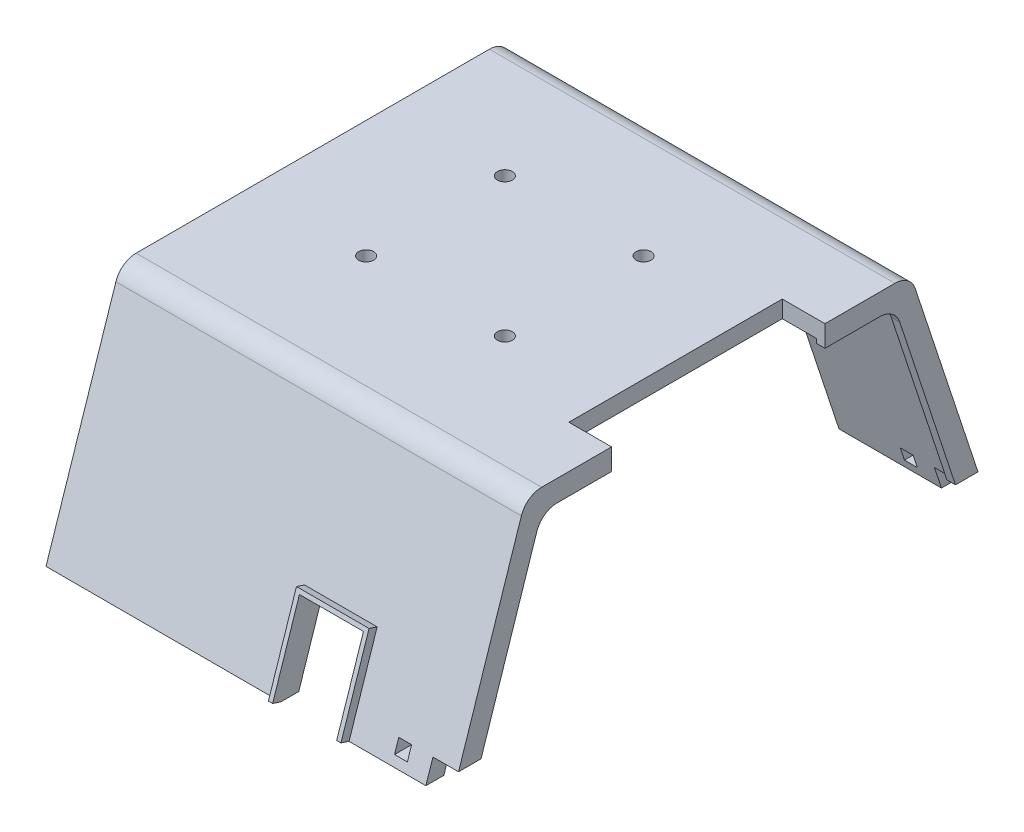
from build123d import *

# Parameters (mm, degrees)
EXTRUDE_1_DEPTH          = 95
EXTRUDE_3_DEPTH          = 20
CUT_EXTRUDE_1_DEPTH      = 142.209950074
CUT_EXTRUDE_1_DEPTH_BACK = 142.209950074
SKETCH_4_W               = 7
SKETCH_4_H               = 3
CUT_EXTRUDE_2_DEPTH      = 142.209950074
SHELL_START              = 2
SHELL_1_DEPTH            = 91
SHELL_START_2            = 93
SHELL_1_2_DEPTH          = 2.83772234
SHELL_1_3_DEPTH          = 3
CUT_EXTRUDE_3_DEPTH      = 3
SKETCH_7_R               = 1.75
SKETCH_7_W               = 10
SKETCH_7_H               = 50
CUT_EXTRUDE_4_DEPTH      = 142.209950074
SKETCH_9_W               = 15
SKETCH_9_H               = 20
CUT_EXTRUDE_5_DEPTH      = 3
EXTRUDE_4_DEPTH          = 2
EXTRUDE_6_DEPTH          = 2
SKETCH_13_W              = 40
SKETCH_13_H              = 28
CUT_EXTRUDE_6_DEPTH      = 2
CUT_EXTRUDE_7_DEPTH      = 10
FILLET_1_R               = 5
FILLET_2_R               = 5
EXTRUDE_7_DEPTH          = 2
EXTRUDE_8_DEPTH          = 2
SKETCH_17_R              = 1.75
EXTRUDE_9_DEPTH          = 2
SKETCH_18_W              = 120.1322677
SKETCH_18_H              = 134.585681159
CUT_EXTRUDE_8_DEPTH      = 2
SKETCH_20_W              = 175.540954957
SKETCH_20_H              = 97.306035525
CUT_EXTRUDE_9_DEPTH      = 39
CUT_EXTRUDE_10_DEPTH     = 39
SKETCH_23_W              = 6
SKETCH_23_H              = 5
SKETCH_23_W_2            = 3
SKETCH_23_H_2            = 3
CUT_EXTRUDE_11_DEPTH     = 181.790250578


with BuildPart() as part:
    # 草图1 → 凸台-拉伸1 (new body)
    with BuildSketch(Plane(origin=(0, 0, 0), x_dir=(0, 0, -1), z_dir=(1, 0, 0))):
        Polygon((-62.5, 0), (-45, 53), (45, 53), (62.5, 0), align=None)
    extrude(amount=EXTRUDE_1_DEPTH)

    # 草图3 → 凸台-拉伸3 (add)
    with BuildSketch(Plane(origin=(95, 0, 0), x_dir=(0, 0, -1), z_dir=(1, 0, 0))):
        Polygon((-60.849056604, 5), (-47.5, 5), (-47.5, 0), (-62.5, 0), align=None)
        Polygon((62.5, 0), (60.849056604, 5), (47.5, 5), (47.5, 0), align=None)
    extrude(amount=EXTRUDE_3_DEPTH)

    # 草图4 → 切除-拉伸1 (cut, two sides: drawn at the far end of the back side and taken through both)
    with BuildSketch(Plane.XY.offset(-CUT_EXTRUDE_1_DEPTH_BACK)):
        with Locations((105, 1.5)):
            Rectangle(SKETCH_4_W, SKETCH_4_H)
    extrude(amount=CUT_EXTRUDE_1_DEPTH + CUT_EXTRUDE_1_DEPTH_BACK, mode=Mode.SUBTRACT)

    # 草图5 → 切除-拉伸2 (cut, through all)
    with BuildSketch(Plane.XZ):
        with BuildLine():
            Line((97.5, -59), (97.5, -51))
            ThreePointArc((97.5, -51), (99, -49.5), (100.5, -51))
            Line((100.5, -51), (100.5, -59))
            ThreePointArc((100.5, -59), (99, -60.5), (97.5, -59))
        make_face()
        with BuildLine():
            Line((109.5, -59), (109.5, -51))
            ThreePointArc((109.5, -51), (111, -49.5), (112.5, -51))
            Line((112.5, -51), (112.5, -59))
            ThreePointArc((112.5, -59), (111, -60.5), (109.5, -59))
        make_face()
        with BuildLine():
            Line((97.5, 51), (97.5, 59))
            ThreePointArc((97.5, 59), (99, 60.5), (100.5, 59))
            Line((100.5, 59), (100.5, 51))
            ThreePointArc((100.5, 51), (99, 49.5), (97.5, 51))
        make_face()
        with BuildLine():
            Line((109.5, 51), (109.5, 59))
            ThreePointArc((109.5, 59), (111, 60.5), (112.5, 59))
            Line((112.5, 59), (112.5, 51))
            ThreePointArc((112.5, 51), (111, 49.5), (109.5, 51))
        make_face()
    extrude(amount=-CUT_EXTRUDE_2_DEPTH, mode=Mode.SUBTRACT)

    # 抽壳1: read off the stored shape, not the designer's step
    # 抽壳1 outline → 抽壳1 (cut)
    with BuildSketch(Plane.YZ.offset(SHELL_START)):
        Polygon((51, 43.554172654), (0, 60.393795296), (0, -60.393795296), (51, -43.554172654), align=None)
    extrude(amount=SHELL_1_DEPTH, mode=Mode.SUBTRACT)

    # Shell 1 2 outline → Shell 1 2 (cut)
    with BuildSketch(Plane.YZ.offset(SHELL_START_2)):
        Polygon((3, 49.5), (3, 59.403229258), (0, 60.393795296), (0, 49.5), align=None)
        Polygon((3, -49.5), (0, -49.5), (0, -60.393795296), (3, -59.403229258), align=None)
    extrude(amount=SHELL_1_2_DEPTH, mode=Mode.SUBTRACT)

    # Shell 1 3 outline → Shell 1 3 (add)
    with BuildSketch(Plane(origin=(0, 0, 0), x_dir=(1, 0, 0), z_dir=(0, 1, 0))):
        with BuildLine():
            Line((95.789496196, -60.393795296), (95.83772234, -60.504880632))
            Line((95.83772234, -60.504880632), (95.83772234, -49.5))
            ThreePointArc((95.83772234, -49.5), (95.585474278, -50.231225589), (95.5, -51))
            Line((95.5, -51), (95.5, -59))
            ThreePointArc((95.5, -59), (95.57313822, -59.711771272), (95.789496196, -60.393795296))
        make_face()
        with BuildLine():
            ThreePointArc((95.789496196, 60.393795296), (95.57313822, 59.711771272), (95.5, 59))
            Line((95.5, 59), (95.5, 51))
            ThreePointArc((95.5, 51), (95.585474278, 50.231225589), (95.83772234, 49.5))
            Line((95.83772234, 49.5), (95.83772234, 60.504880632))
            Line((95.83772234, 60.504880632), (95.789496196, 60.393795296))
        make_face()
    extrude(amount=SHELL_1_3_DEPTH)

    # 草图6 → 切除-拉伸3 (cut)
    with BuildSketch(Plane(origin=(95, 0, 0), x_dir=(0, 0, -1), z_dir=(1, 0, 0))):
        with BuildLine():
            Line((-37.770863272, 48), (37.770863272, 48))
            ThreePointArc((37.770863272, 48), (40.700157086, 47.052065862), (42.518739858, 44.567695099))
            Line((42.518739858, 44.567695099), (55.583544844, 5))
            Line((55.583544844, 5), (47.5, 5))
            Line((47.5, 5), (47.5, 0))
            Line((47.5, 0), (-47.5, 0))
            Line((-47.5, 0), (-47.5, 5))
            Line((-47.5, 5), (-55.583544844, 5))
            Line((-55.583544844, 5), (-42.518739858, 44.567695099))
            ThreePointArc((-42.518739858, 44.567695099), (-40.700157086, 47.052065862), (-37.770863272, 48))
        make_face()
    extrude(amount=-CUT_EXTRUDE_3_DEPTH, mode=Mode.SUBTRACT)

    # 草图7 → 切除-拉伸4 (cut, through all)
    with BuildSketch(Plane(origin=(0, 53, 0), x_dir=(1, 0, 0), z_dir=(0, 1, 0))):
        with Locations(Location((60, -15, 0), (0, 0, 270))):
            Circle(SKETCH_7_R)
        with Locations(Location((60, 17.5, 0), (0, 0, 270))):
            Circle(SKETCH_7_R)
        with Locations(Location((27.5, 17.5, 0), (0, 0, 270))):
            Circle(SKETCH_7_R)
        with Locations(Location((27.5, -15, 0), (0, 0, 270))):
            Circle(SKETCH_7_R)
        with Locations((90, 0)):
            Rectangle(SKETCH_7_W, SKETCH_7_H)
    extrude(amount=-CUT_EXTRUDE_4_DEPTH, mode=Mode.SUBTRACT)

    # 草图9 → 切除-拉伸5 (cut)
    with BuildSketch(Plane(origin=(0, 18.608057138, 56.35583019), x_dir=(1, 0, 0), z_dir=(0, 0.3135390198315126, 0.949575317204009))):
        with Locations((62.5, -9.596188739)):
            Rectangle(SKETCH_9_W, SKETCH_9_H)
    extrude(amount=-CUT_EXTRUDE_5_DEPTH, mode=Mode.SUBTRACT)

    # 草图10 → 凸台-拉伸4 (add)
    with BuildSketch(Plane(origin=(0, 18.608057138, 56.35583019), x_dir=(1, 0, 0), z_dir=(0, 0.3135390198315126, 0.949575317204009))):
        Polygon((55, -19.596188739), (54, -19.596188739), (54, 1.403811261), (71, 1.403811261), (71, -19.596188739), (70, -19.596188739), (70, 0.403811261), (55, 0.403811261), align=None)
    extrude(amount=EXTRUDE_4_DEPTH)

    # 草图11 → 凸台-拉伸6 (add)
    with BuildSketch(Plane(origin=(0, 18.608057138, -56.35583019), x_dir=(-1, 0, 0), z_dir=(0, 0.3135390198315126, -0.949575317204009))):
        Polygon((-67, -19.596188739), (-67, 10.403811261), (-23, 10.403811261), (-23, -19.596188739), (-25, -19.596188739), (-25, 8.403811261), (-65, 8.403811261), (-65, -19.596188739), align=None)
    extrude(amount=EXTRUDE_6_DEPTH)

    # 草图13 → 切除-拉伸6 (cut)
    with BuildSketch(Plane(origin=(0, 18.608057138, -56.35583019), x_dir=(-1, 0, 0), z_dir=(0, 0.3135390198315126, -0.949575317204009))):
        with Locations((-45, -5.596188739)):
            Rectangle(SKETCH_13_W, SKETCH_13_H)
    extrude(amount=-CUT_EXTRUDE_6_DEPTH, mode=Mode.SUBTRACT)

    # 草图14 → 切除-拉伸7 (cut)
    with BuildSketch(Plane.ZY):
        Polygon((-41.385431636, 48), (41.385431636, 48), (57.23448824, 0), (-57.23448824, 0), align=None)
    extrude(amount=-CUT_EXTRUDE_7_DEPTH, mode=Mode.SUBTRACT)

    # 圆角1
    fillet_1_edges = [part.edges().sort_by_distance(p)[0] for p in [
        (47.5, 53, 45),
        (47.5, 53, -45),
    ]]
    fillet(fillet_1_edges, radius=FILLET_1_R)

    # 圆角2
    fillet_2_edges = [part.edges().sort_by_distance(p)[0] for p in [
        (1, 48, -41.385431636),
        (1, 48, 41.385431636),
    ]]
    fillet(fillet_2_edges, radius=FILLET_2_R)

    # 草图15 → 凸台-拉伸7 (add)
    with BuildSketch(Plane(origin=(0, 17.980979099, 54.456679556), x_dir=(-1, 0, 0), z_dir=(0, -0.3135390198315126, -0.949575317204009))):
        with BuildLine():
            Line((-70, -18.935811381), (-70, 0.403811261))
            Line((-70, 0.403811261), (-55, 0.403811261))
            Line((-55, 0.403811261), (-55, -18.935811381))
            Line((-55, -18.935811381), (-2, -18.935811381))
            Line((-2, -18.935811381), (-2, 34.772408574))
            Line((-2, 34.772408574), (-93, 34.772408574))
            Line((-93, 34.772408574), (-93, -15.776504325))
            Line((-93, -15.776504325), (-95.523305282, -15.776504325))
            add(Edge.make_bspline(
                [(-95.789496196, -18.935811381), (-95.583035108, -17.41903761), (-95.523305282, -15.776504325)],
                knots=[1.16121292, 1.16121292, 1.16121292, 1.455331574, 1.455331574, 1.455331574], degree=2, weights=[1, 0.989206251, 1]))
            Line((-95.789496196, -18.935811381), (-70, -18.935811381))
        make_face()
    extrude(amount=EXTRUDE_7_DEPTH)

    # 草图16 → 凸台-拉伸8 (add)
    with BuildSketch(Plane(origin=(0, 17.980979099, -54.456679556), x_dir=(1, 0, 0), z_dir=(0, -0.3135390198315126, 0.949575317204009))):
        with BuildLine():
            Line((65, 8.403811261), (65, -18.935811381))
            Line((65, -18.935811381), (95.789496196, -18.935811381))
            add(Edge.make_bspline(
                [(95.523305282, -15.776504325), (95.583035108, -17.41903761), (95.789496196, -18.935811381)],
                knots=[4.827853734, 4.827853734, 4.827853734, 5.121972388, 5.121972388, 5.121972388], degree=2, weights=[1, 0.989206251, 1]))
            Line((95.523305282, -15.776504325), (93, -15.776504325))
            Line((93, -15.776504325), (93, 34.772408574))
            Line((93, 34.772408574), (2, 34.772408574))
            Line((2, 34.772408574), (2, -18.935811381))
            Line((2, -18.935811381), (25, -18.935811381))
            Line((25, -18.935811381), (25, 8.403811261))
            Line((25, 8.403811261), (65, 8.403811261))
        make_face()
    extrude(amount=EXTRUDE_8_DEPTH)

    # 草图17 → 凸台-拉伸9 (add)
    with BuildSketch(Plane.XZ.offset(-51)):
        Polygon((85, 25), (93, 25), (93, 43.554172654), (2, 43.554172654), (2, -43.554172654), (93, -43.554172654), (93, -25), (85, -25), align=None)
        with Locations(Location((60, -17.5, 0), (0, 0, 90))):
            Circle(SKETCH_17_R, mode=Mode.SUBTRACT)
        with Locations(Location((27.5, -17.5, 0), (0, 0, 90))):
            Circle(SKETCH_17_R, mode=Mode.SUBTRACT)
        with Locations(Location((60, 15, 0), (0, 0, 90))):
            Circle(SKETCH_17_R, mode=Mode.SUBTRACT)
        with Locations(Location((27.5, 15, 0), (0, 0, 90))):
            Circle(SKETCH_17_R, mode=Mode.SUBTRACT)
    extrude(amount=EXTRUDE_9_DEPTH)

    # 草图18 → 切除-拉伸8 (cut)
    with BuildSketch(Plane(origin=(0, 0, 0), x_dir=(1, 0, 0), z_dir=(0, 1, 0))):
        with Locations((58.156973339, 0.12316308)):
            Rectangle(SKETCH_18_W, SKETCH_18_H)
    extrude(amount=-CUT_EXTRUDE_8_DEPTH, mode=Mode.SUBTRACT)

    # 草图20 → 切除-拉伸9 (cut)
    with BuildSketch(Plane(origin=(95, 0, 0), x_dir=(0, 0, -1), z_dir=(1, 0, 0))):
        with Locations((3.171805167, 26.174924158)):
            Rectangle(SKETCH_20_W, SKETCH_20_H)
    extrude(amount=CUT_EXTRUDE_9_DEPTH, mode=Mode.SUBTRACT)

    # 草图21 → 切除-拉伸10 (cut)
    with BuildSketch(Plane(origin=(95, 0, 0), x_dir=(0, 0, -1), z_dir=(1, 0, 0))):
        Polygon((-43.861204642, 40.501944611), (-57.23448824, 0), (57.23448824, 0), (43.861204642, 40.501944611), align=None)
    extrude(amount=-CUT_EXTRUDE_10_DEPTH, mode=Mode.SUBTRACT)

    # 草图23 → 切除-拉伸11 (cut, through all)
    with BuildSketch(Plane.XY.offset(-80)):
        with Locations((92, 2.5)):
            Rectangle(SKETCH_23_W, SKETCH_23_H)
        with Locations((82.5, 3.5)):
            Rectangle(SKETCH_23_W_2, SKETCH_23_H_2)
    extrude(amount=CUT_EXTRUDE_11_DEPTH, mode=Mode.SUBTRACT)


solid = part.part
